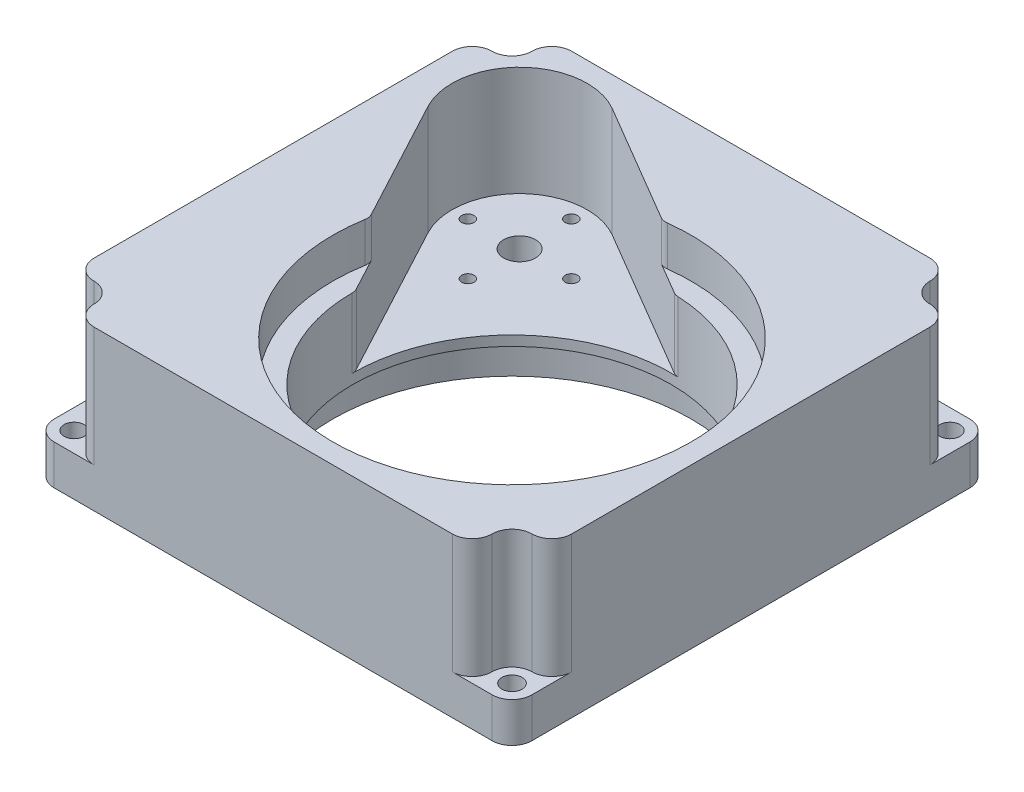
from build123d import *

# Parameters (mm, degrees)
SKETCH1_W           = 120
SKETCH1_H           = 120
BOSS_EXTRUDE1_DEPTH = 40
SKETCH2_R           = 40
CUT_EXTRUDE1_DEPTH  = 94.808315196
SKETCH3_R           = 45
CUT_EXTRUDE2_DEPTH  = 10
CUT_EXTRUDE3_START  = -10
SKETCH4_R           = 45
CUT_EXTRUDE3_DEPTH  = 10
SKETCH11_W          = 10
SKETCH11_H          = 10
CUT_EXTRUDE8_DEPTH  = 30
SKETCH7_R           = 17
CUT_EXTRUDE5_DEPTH  = 27.5
CUT_EXTRUDE10_START = -5
SKETCH13_R          = 17
CUT_EXTRUDE10_DEPTH = 5
SKETCH14_R          = 4
SKETCH14_R_2        = 1.55
CUT_EXTRUDE11_DEPTH = 90.197813875
CUT_EXTRUDE7_REACH  = 95.808
SKETCH12_R          = 2.55
CUT_EXTRUDE9_DEPTH  = 91
FILLET1_R           = 5
FILLET2_R           = 5
FILLET3_R           = 3


with BuildPart() as part:
    # Sketch1 → Boss-Extrude1 (new body)
    with BuildSketch(Plane(origin=(0, 0, 0), x_dir=(1, 0, 0), z_dir=(0, 1, 0))):
        Rectangle(SKETCH1_W, SKETCH1_H)
    extrude(amount=BOSS_EXTRUDE1_DEPTH)

    # Sketch2 → Cut-Extrude1 (cut, through all)
    with BuildSketch(Plane(origin=(0, 40, 0), x_dir=(1, 0, 0), z_dir=(0, 1, 0))):
        with Locations(Location((10, -10, 0), (0, 0, 270))):
            Circle(SKETCH2_R)
    extrude(amount=-CUT_EXTRUDE1_DEPTH, mode=Mode.SUBTRACT)

    # Sketch3 → Cut-Extrude2 (cut)
    with BuildSketch(Plane(origin=(0, 40, 0), x_dir=(1, 0, 0), z_dir=(0, 1, 0))):
        with Locations(Location((10, -10, 0), (0, 0, 270))):
            Circle(SKETCH3_R)
    extrude(amount=-CUT_EXTRUDE2_DEPTH, mode=Mode.SUBTRACT)

    # Sketch4 → Cut-Extrude3 (cut)
    with BuildSketch(Plane.XZ.offset(CUT_EXTRUDE3_START)):
        with Locations(Location((10, 10, 0), (0, 0, 90))):
            Circle(SKETCH4_R)
    extrude(amount=CUT_EXTRUDE3_DEPTH, mode=Mode.SUBTRACT)

    # Sketch11 → Cut-Extrude8 (cut)
    with BuildSketch(Plane(origin=(0, 40, 0), x_dir=(1, 0, 0), z_dir=(0, 1, 0))):
        with Locations((-55, 55)):
            Rectangle(SKETCH11_W, SKETCH11_H)
        with Locations((55, 55)):
            Rectangle(SKETCH11_W, SKETCH11_H)
        with Locations((55, -55)):
            Rectangle(SKETCH11_W, SKETCH11_H)
        with Locations((-55, -55)):
            Rectangle(SKETCH11_W, SKETCH11_H)
    extrude(amount=-CUT_EXTRUDE8_DEPTH, mode=Mode.SUBTRACT)

    # Sketch7 → Cut-Extrude5 (cut)
    with BuildSketch(Plane(origin=(0, 40, 0), x_dir=(1, 0, 0), z_dir=(0, 1, 0))):
        with Locations(Location((-36.059780402, 37.96609875, 0), (0, 0, 270))):
            Circle(SKETCH7_R)
    extrude(amount=-CUT_EXTRUDE5_DEPTH, mode=Mode.SUBTRACT)

    # Sketch13 → Cut-Extrude10 (cut)
    with BuildSketch(Plane.XZ.offset(CUT_EXTRUDE10_START)):
        with Locations(Location((-36.059780402, -37.96609875, 0), (0, 0, 90))):
            Circle(SKETCH13_R)
    extrude(amount=CUT_EXTRUDE10_DEPTH, mode=Mode.SUBTRACT)

    # Sketch14 → Cut-Extrude11 (cut, through all)
    with BuildSketch(Plane(origin=(0, 12.5, 0), x_dir=(1, 0, 0), z_dir=(0, 1, 0))):
        with Locations(Location((-36.059780402, 37.96609875, 0), (0, 0, 270))):
            Circle(SKETCH14_R)
        with Locations(Location((-36.059780402, 50.96609875, 0), (0, 0, 270))):
            Circle(SKETCH14_R_2)
        with Locations(Location((-23.059780402, 37.96609875, 0), (0, 0, 270))):
            Circle(SKETCH14_R_2)
        with Locations(Location((-36.059780402, 24.96609875, 0), (0, 0, 270))):
            Circle(SKETCH14_R_2)
        with Locations(Location((-49.059780402, 37.96609875, 0), (0, 0, 270))):
            Circle(SKETCH14_R_2)
    extrude(amount=-CUT_EXTRUDE11_DEPTH, mode=Mode.SUBTRACT)

    # Cut-Extrude7: up to this face of the body (flat: up to its plane)
    cut_extrude7_end = Plane(part.part.faces().sort_by_distance((-36.059780402, 12.5, -54.485266139))[0])
    # Sketch10 → Cut-Extrude7 (cut, up to the picked face)
    with BuildSketch(Plane(origin=(0, 40, 0), x_dir=(1, 0, 0), z_dir=(0, 1, 0)), mode=Mode.PRIVATE) as cut_extrude7_sk1:
        with BuildLine():
            Line((-27.442638837, 52.620274648), (27.741173812, 20.170362142))
            ThreePointArc((27.741173812, 20.170362142), (34.241989685, -35.245315132), (-20.864656949, -26.503725379))
            Line((-20.864656949, -26.503725379), (-51.051185206, 29.950003566))
            ThreePointArc((-51.051185206, 29.950003566), (-47.834461107, 50.228108957), (-27.442638837, 52.620274648))
        make_face()
    cut_extrude7_tool1 = split(extrude(cut_extrude7_sk1.sketch, amount=-CUT_EXTRUDE7_REACH, mode=Mode.PRIVATE), bisect_by=cut_extrude7_end, keep=Keep.BOTH, mode=Mode.PRIVATE)
    add(cut_extrude7_tool1.solids().sort_by(Axis((-2.85152, 40, -3.383418), (0, -1, 0)))[0], mode=Mode.SUBTRACT)

    # Sketch12 → Cut-Extrude9 (cut, through all)
    with BuildSketch(Plane(origin=(0, 10, 0), x_dir=(1, 0, 0), z_dir=(0, 1, 0))):
        with Locations(Location((-55, 55, 0), (0, 0, 270))):
            Circle(SKETCH12_R)
        with Locations(Location((55, 55, 0), (0, 0, 270))):
            Circle(SKETCH12_R)
        with Locations(Location((55, -55, 0), (0, 0, 270))):
            Circle(SKETCH12_R)
        with Locations(Location((-55, -55, 0), (0, 0, 270))):
            Circle(SKETCH12_R)
    extrude(amount=-CUT_EXTRUDE9_DEPTH, mode=Mode.SUBTRACT)

    # Fillet1
    fillet1_edges = [part.edges().sort_by_distance(p)[0] for p in [
        (-60, 5, -60),
        (-50, 25, -50),
        (60, 5, -60),
        (50, 25, -50),
        (60, 5, 60),
        (50, 25, 50),
        (-60, 5, 60),
        (-50, 25, 50),
    ]]
    fillet(fillet1_edges, radius=FILLET1_R)

    # Fillet2
    fillet2_edges = [part.edges().sort_by_distance(p)[0] for p in [
        (50, 25, -60),
        (60, 25, -50),
        (60, 25, 50),
        (-50, 25, 60),
        (-60, 25, 50),
        (-50, 25, -60),
        (-60, 25, -50),
        (50, 25, 60),
    ]]
    fillet(fillet2_edges, radius=FILLET2_R - 0.0001)  # a hair under: the kernel refuses the full size

    # Fillet3
    fillet3_edges = [part.edges().sort_by_distance(p)[0] for p in [
        (-29.99589317, 21.25, 9.426825043),
        (-34.201681099, 35, 1.561315976),
        (11.048415222, 21.25, -29.986257958),
        (3.359839341, 35, -34.507395637),
    ]]
    fillet(fillet3_edges, radius=FILLET3_R)


solid = part.part
